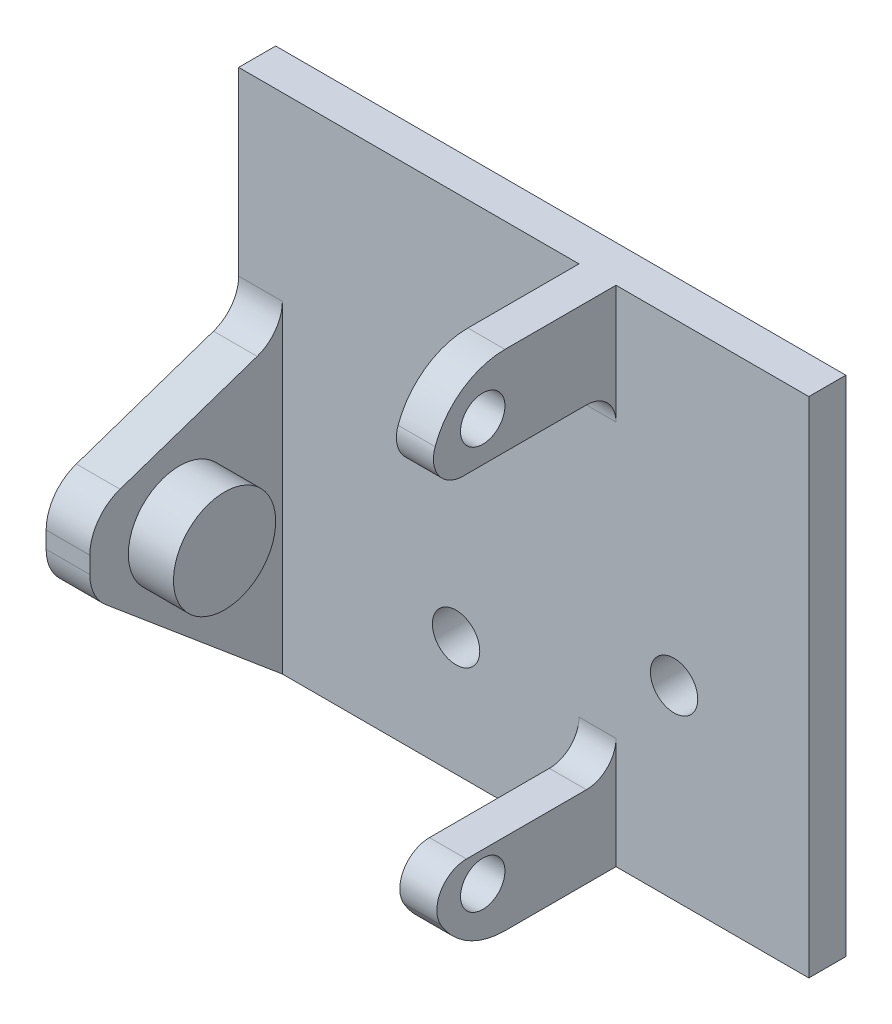
from build123d import *

# Parameters (mm, degrees)
ESBO_O1_W                = 38.5
ESBO_O1_H                = 34
RESSALTO_EXTRUS_O1_DEPTH = 2.5
ESBO_O2_W                = 2.5
ESBO_O2_H                = 6
ESBO_O2_H_2              = 5.5
RESSALTO_EXTRUS_O2_DEPTH = 12.5
CORTE_EXTRUS_O1_REACH    = 42.236
ESBO_O3_R                = 1.5
ESBO_O4_W                = 2.95
ESBO_O4_H                = 20
RESSALTO_EXTRUS_O3_DEPTH = 13
ESBO_O5_R                = 3.45
CORTE_EXTRUS_O2_DEPTH    = 15
FILETE1_R                = 3
FILETE2_R                = 2.5
ESBO_O7_R                = 3.45
RESSALTO_EXTRUS_O5_DEPTH = 6
ESBO_O8_R                = 1.6
CORTE_EXTRUS_O3_DEPTH    = 6
FILETE3_R                = 2
FILETE4_R                = 5
FILETE5_R                = 2


with BuildPart() as part:
    # Esboço1 → Ressalto-extrusão1 (new body)
    with BuildSketch(Plane.XY):
        with Locations((-3.395014232, -10.289862205)):
            Rectangle(ESBO_O1_W, ESBO_O1_H)
    extrude(amount=RESSALTO_EXTRUS_O1_DEPTH)

    # Esboço2 → Ressalto-extrusão2 (add)
    with BuildSketch(Plane.XY.offset(2.5)):
        with Locations((1.584985768, 3.710137795)):
            Rectangle(ESBO_O2_W, ESBO_O2_H)
        with Locations((1.584985768, -24.539862205)):
            Rectangle(ESBO_O2_W, ESBO_O2_H_2)
    extrude(amount=RESSALTO_EXTRUS_O2_DEPTH)

    # Esboço3 → Corte-extrusão1 (cut, up to next)
    with BuildSketch(Plane(origin=(2.834985768, 0, 0), x_dir=(0, 0, -1), z_dir=(1, 0, 0)), mode=Mode.PRIVATE) as corte_extrus_o1_sk1:
        with Locations(Location((-11.5, 3.410137795, 0), (0, 0, 90))):
            Circle(ESBO_O3_R)
    corte_extrus_o1_tool1 = extrude(corte_extrus_o1_sk1.sketch, amount=-CORTE_EXTRUS_O1_REACH, mode=Mode.PRIVATE) & part.part
    # Esboço3 → Corte-extrusão1 (cut, up to next)
    with BuildSketch(Plane(origin=(2.834985768, 0, 0), x_dir=(0, 0, -1), z_dir=(1, 0, 0)), mode=Mode.PRIVATE) as corte_extrus_o1_sk2:
        with Locations(Location((-11.5, -23.789862205, 0), (0, 0, 90))):
            Circle(ESBO_O3_R)
    corte_extrus_o1_tool2 = extrude(corte_extrus_o1_sk2.sketch, amount=-CORTE_EXTRUS_O1_REACH, mode=Mode.PRIVATE) & part.part
    add(corte_extrus_o1_tool1.solids().sort_by_distance((2.834986, 3.410138, 11.5))[0], mode=Mode.SUBTRACT)
    add(corte_extrus_o1_tool2.solids().sort_by_distance((2.834986, -23.789862, 11.5))[0], mode=Mode.SUBTRACT)

    # Esboço4 → Ressalto-extrusão3 (add)
    with BuildSketch(Plane.XY.offset(2.5)):
        with Locations((-21.170014232, -17.289862205)):
            Rectangle(ESBO_O4_W, ESBO_O4_H)
    extrude(amount=RESSALTO_EXTRUS_O3_DEPTH)

    # Esboço5 → Corte-extrusão2 (cut)
    with BuildSketch(Plane.ZY.offset(22.645014232)):
        Polygon((2.5, -7.289862205), (15.222036194, -11.595443281), (15.5, -11.689515935), (15.5, -7.289862205), align=None)
        Polygon((15.222036194, -16.59994967), (2.5, -27.289862205), (15.5, -27.289862205), (15.5, -16.36638574), align=None)
        with Locations(Location((9.45, -15.089862205, 0), (0, 0, 270))):
            Circle(ESBO_O5_R)
    extrude(amount=-CORTE_EXTRUS_O2_DEPTH, mode=Mode.SUBTRACT)

    # Filete1
    filete1_edges = [part.edges().sort_by_distance(p)[0] for p in [
        (-21.170014232, -11.689515935, 15.5),
        (-21.170014232, -16.36638574, 15.5),
    ]]
    fillet(filete1_edges, radius=FILETE1_R)

    # Filete2
    # the kernel refuses this fillet: 2.5 mm, written as the material it adds along each edge
    with BuildSketch(Plane(origin=(-19.695014232, -7.289862205, 2.5), x_dir=(0, -0.32057353707536407, 0.947223631106715), z_dir=(-1, 0, 0))) as filete2_piece_1:
        with BuildLine():
            CenterArc((FILETE2_R * 0.717282002488, FILETE2_R), FILETE2_R, 198.697613514, 71.302386486)
            Line((-FILETE2_R * 0.229941628618, FILETE2_R * 0.679426462925), (0, 0))
            Line((0, 0), (FILETE2_R * 0.717282002488, 0))
        make_face()
    extrude(amount=2.95)

    # Esboço7 → Ressalto-extrusão5 (add)
    with BuildSketch(Plane.ZY.offset(22.645014232)):
        with Locations(Location((9.45, -15.089862205, 0), (0, 0, 270))):
            Circle(ESBO_O7_R)
    extrude(amount=-RESSALTO_EXTRUS_O5_DEPTH)

    # Esboço8 → Corte-extrusão3 (cut)
    with BuildSketch(Plane(origin=(0, 0, 0), x_dir=(-1, 0, 0), z_dir=(0, 0, -1))):
        with Locations((7.965014232, -19.289862205)):
            Circle(ESBO_O8_R)
        with Locations((-6.754985768, -14.739862205)):
            Circle(ESBO_O8_R)
    extrude(amount=-CORTE_EXTRUS_O3_DEPTH, mode=Mode.SUBTRACT)

    # Filete3
    filete3_edges = [part.edges().sort_by_distance(p)[0] for p in [
        (1.584985768, -21.789862205, 2.5),
        (1.584985768, 0.710137795, 2.5),
    ]]
    fillet(filete3_edges, radius=FILETE3_R)

    # Filete4
    filete4_edges = [part.edges().sort_by_distance(p)[0] for p in [
        (1.584985768, -27.289862205, 15),
        (1.584985768, 6.710137795, 15),
    ]]
    fillet(filete4_edges, radius=FILETE4_R)

    # Filete5
    filete5_edges = [part.edges().sort_by_distance(p)[0] for p in [
        (1.584985768, 0.710137795, 15),
        (1.584985768, -21.789862205, 15),
    ]]
    fillet(filete5_edges, radius=FILETE5_R)


solid = part.part
